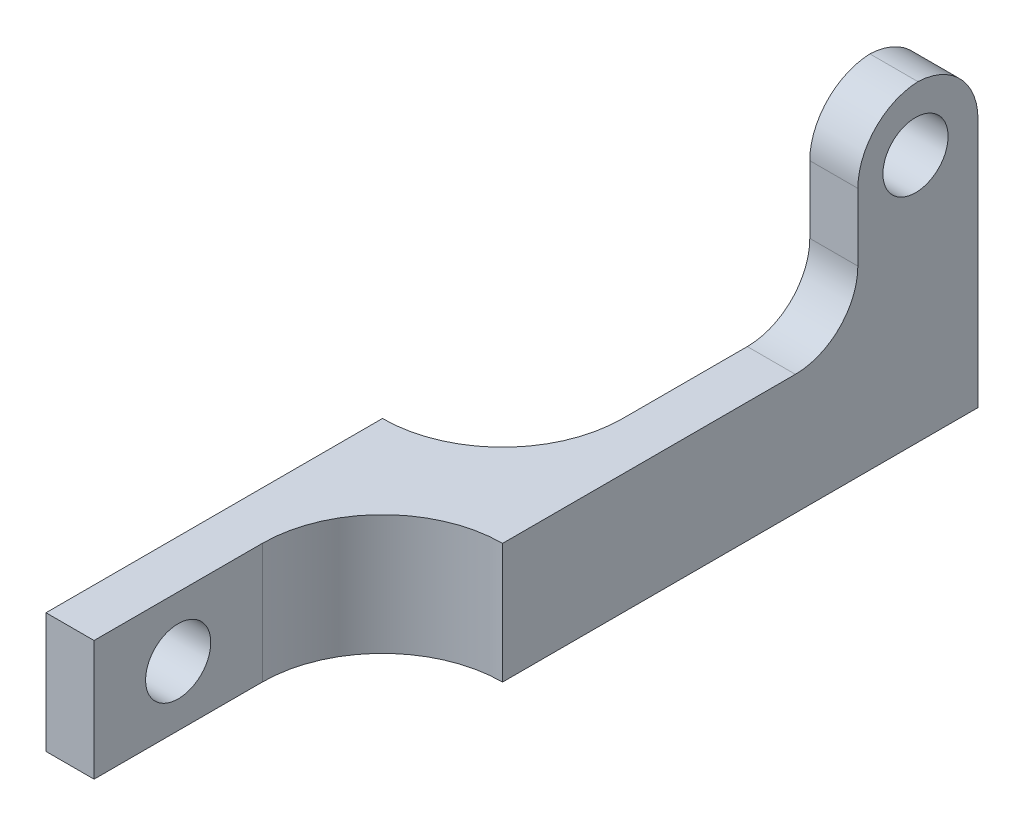
from build123d import *

# Parameters (mm, degrees)
BOSS_EXTRUDE1_DEPTH   = 7.9375
FILLET1_R             = 7.9375
SKETCH6_W             = 3.175
SKETCH6_H             = 7.9375
BOSS_EXTRUDE2_DEPTH   = 12.7
FILLET2_R             = 4.1275
FILLET3_R             = 4.1275
F_6_CLEARANCE_HOLE1_D = 4.3053


# Some blends are built 0.0001 mm under size
with BuildPart() as part:
    # Sketch1 → Boss-Extrude1 (new body)
    with BuildSketch(Plane(origin=(0, 0, 0), x_dir=(1, 0, 0), z_dir=(0, 1, 0))):
        Polygon((0, 0), (0, 22.225), (7.9375, 22.225), (7.9375, 50.45837), (11.1125, 50.45837), (11.1125, 19.05), (3.175, 19.05), (3.175, 0), align=None)
    extrude(amount=BOSS_EXTRUDE1_DEPTH)

    # Fillet1
    fillet1_edges = [part.edges().sort_by_distance(p)[0] for p in [
        (7.9375, 3.96875, -22.225),
        (3.175, 3.96875, -19.05),
    ]]
    fillet(fillet1_edges, radius=FILLET1_R - 0.0001)  # a hair under: the kernel refuses the full size

    # Sketch6 → Boss-Extrude2 (add)
    with BuildSketch(Plane(origin=(0, 7.9375, 0), x_dir=(1, 0, 0), z_dir=(0, 1, 0))):
        with Locations((9.525, 46.48962)):
            Rectangle(SKETCH6_W, SKETCH6_H)
    extrude(amount=BOSS_EXTRUDE2_DEPTH)

    # Fillet2
    # the kernel refuses this fillet: 4.1275 mm, written as the material it takes off along each edge
    with BuildSketch(Plane(origin=(21.43125, 20.6375, -50.45837), x_dir=(0, -1, 0), z_dir=(-1, 0, 0))) as fillet2_piece_1:
        with BuildLine():
            CenterArc((FILLET2_R, FILLET2_R), FILLET2_R, 180, 90)
            Line((0, FILLET2_R), (0, 0))
            Line((0, 0), (FILLET2_R, 0))
        make_face()
    extrude(amount=23.8125, mode=Mode.SUBTRACT)
    with BuildSketch(Plane(origin=(-2.38125, 20.6375, -42.52087), x_dir=(0, 0, -1), z_dir=(1, 0, 0))) as fillet2_piece_2:
        with BuildLine():
            CenterArc((FILLET2_R, -FILLET2_R), FILLET2_R, 90, 90)
            Line((0, -FILLET2_R), (0, 0))
            Line((0, 0), (FILLET2_R, 0))
        make_face()
    extrude(amount=23.8125, mode=Mode.SUBTRACT)

    # Fillet3
    fillet3_edges = [part.edges().sort_by_distance(p)[0] for p in [
        (9.525, 7.9375, -42.52087),
    ]]
    fillet(fillet3_edges, radius=FILLET3_R)

    # #6 Clearance Hole1 (through all)
    with Locations(Plane(origin=(0, 0, 0), x_dir=(0, 0, -1), z_dir=(-1, 0, 0))):
        with Locations((5.55625, -3.96875), (46.33087, -16.51)):
            Hole(F_6_CLEARANCE_HOLE1_D / 2)


solid = part.part
